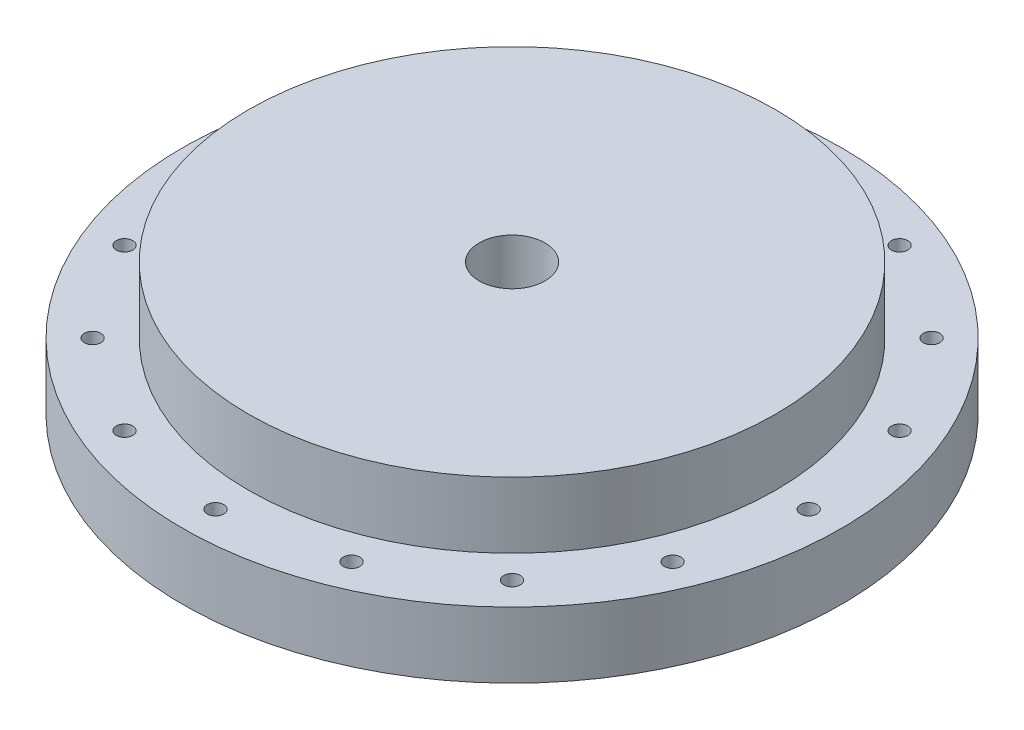
from build123d import *

# Parameters (mm, degrees)
SKETCH1_R           = 50.8
BOSS_EXTRUDE1_DEPTH = 25.4
SKETCH2_R           = 63.5
SKETCH2_R_2         = 50.8
BOSS_EXTRUDE2_DEPTH = 12.7
SKETCH3_R           = 50.00625
SKETCH3_R_2         = 47.625
CUT_EXTRUDE1_DEPTH  = 1.190625
CUT_EXTRUDE2_REACH  = 95.326
SKETCH4_R           = 1.5875
SKETCH5_R           = 6.35
CUT_EXTRUDE3_DEPTH  = 12.7
CUT_EXTRUDE4_REACH  = 92.696
SKETCH6_R           = 1.5875


with BuildPart() as part:
    # Sketch1 → Boss-Extrude1 (new body)
    with BuildSketch(Plane(origin=(0, 0, 0), x_dir=(1, 0, 0), z_dir=(0, 1, 0))):
        Circle(SKETCH1_R)
    extrude(amount=BOSS_EXTRUDE1_DEPTH)

    # Sketch2 → Boss-Extrude2 (add)
    with BuildSketch(Plane.XZ):
        Circle(SKETCH2_R)
        Circle(SKETCH2_R_2, mode=Mode.SUBTRACT)
    extrude(amount=-BOSS_EXTRUDE2_DEPTH)

    # Sketch3 → Cut-Extrude1 (cut)
    with BuildSketch(Plane.XZ):
        Circle(SKETCH3_R)
        Circle(SKETCH3_R_2, mode=Mode.SUBTRACT)
    extrude(amount=-CUT_EXTRUDE1_DEPTH, mode=Mode.SUBTRACT)

    # Sketch4 → Cut-Extrude2 (cut, up to next)
    with BuildSketch(Plane.XZ, mode=Mode.PRIVATE) as cut_extrude2_sk1:
        with Locations((0, -57.15)):
            Circle(SKETCH4_R)
    cut_extrude2_tool1 = extrude(cut_extrude2_sk1.sketch, amount=-CUT_EXTRUDE2_REACH, mode=Mode.PRIVATE) & part.part
    # Sketch4 → Cut-Extrude2 (cut, up to next)
    with BuildSketch(Plane.XZ, mode=Mode.PRIVATE) as cut_extrude2_sk2:
        with Locations((-21.87035816, -52.799715283)):
            Circle(SKETCH4_R)
    cut_extrude2_tool2 = extrude(cut_extrude2_sk2.sketch, amount=-CUT_EXTRUDE2_REACH, mode=Mode.PRIVATE) & part.part
    # Sketch4 → Cut-Extrude2 (cut, up to next)
    with BuildSketch(Plane.XZ, mode=Mode.PRIVATE) as cut_extrude2_sk3:
        with Locations((-40.411152545, -40.411152545)):
            Circle(SKETCH4_R)
    cut_extrude2_tool3 = extrude(cut_extrude2_sk3.sketch, amount=-CUT_EXTRUDE2_REACH, mode=Mode.PRIVATE) & part.part
    # Sketch4 → Cut-Extrude2 (cut, up to next)
    with BuildSketch(Plane.XZ, mode=Mode.PRIVATE) as cut_extrude2_sk4:
        with Locations((-52.799715283, -21.87035816)):
            Circle(SKETCH4_R)
    cut_extrude2_tool4 = extrude(cut_extrude2_sk4.sketch, amount=-CUT_EXTRUDE2_REACH, mode=Mode.PRIVATE) & part.part
    # Sketch4 → Cut-Extrude2 (cut, up to next)
    with BuildSketch(Plane.XZ, mode=Mode.PRIVATE) as cut_extrude2_sk5:
        with Locations((-57.15, 0)):
            Circle(SKETCH4_R)
    cut_extrude2_tool5 = extrude(cut_extrude2_sk5.sketch, amount=-CUT_EXTRUDE2_REACH, mode=Mode.PRIVATE) & part.part
    # Sketch4 → Cut-Extrude2 (cut, up to next)
    with BuildSketch(Plane.XZ, mode=Mode.PRIVATE) as cut_extrude2_sk6:
        with Locations((-52.799715283, 21.87035816)):
            Circle(SKETCH4_R)
    cut_extrude2_tool6 = extrude(cut_extrude2_sk6.sketch, amount=-CUT_EXTRUDE2_REACH, mode=Mode.PRIVATE) & part.part
    # Sketch4 → Cut-Extrude2 (cut, up to next)
    with BuildSketch(Plane.XZ, mode=Mode.PRIVATE) as cut_extrude2_sk7:
        with Locations((-40.411152545, 40.411152545)):
            Circle(SKETCH4_R)
    cut_extrude2_tool7 = extrude(cut_extrude2_sk7.sketch, amount=-CUT_EXTRUDE2_REACH, mode=Mode.PRIVATE) & part.part
    # Sketch4 → Cut-Extrude2 (cut, up to next)
    with BuildSketch(Plane.XZ, mode=Mode.PRIVATE) as cut_extrude2_sk8:
        with Locations((-21.87035816, 52.799715283)):
            Circle(SKETCH4_R)
    cut_extrude2_tool8 = extrude(cut_extrude2_sk8.sketch, amount=-CUT_EXTRUDE2_REACH, mode=Mode.PRIVATE) & part.part
    # Sketch4 → Cut-Extrude2 (cut, up to next)
    with BuildSketch(Plane.XZ, mode=Mode.PRIVATE) as cut_extrude2_sk9:
        with Locations((0, 57.15)):
            Circle(SKETCH4_R)
    cut_extrude2_tool9 = extrude(cut_extrude2_sk9.sketch, amount=-CUT_EXTRUDE2_REACH, mode=Mode.PRIVATE) & part.part
    # Sketch4 → Cut-Extrude2 (cut, up to next)
    with BuildSketch(Plane.XZ, mode=Mode.PRIVATE) as cut_extrude2_sk10:
        with Locations((21.87035816, 52.799715283)):
            Circle(SKETCH4_R)
    cut_extrude2_tool10 = extrude(cut_extrude2_sk10.sketch, amount=-CUT_EXTRUDE2_REACH, mode=Mode.PRIVATE) & part.part
    # Sketch4 → Cut-Extrude2 (cut, up to next)
    with BuildSketch(Plane.XZ, mode=Mode.PRIVATE) as cut_extrude2_sk11:
        with Locations((40.411152545, 40.411152545)):
            Circle(SKETCH4_R)
    cut_extrude2_tool11 = extrude(cut_extrude2_sk11.sketch, amount=-CUT_EXTRUDE2_REACH, mode=Mode.PRIVATE) & part.part
    # Sketch4 → Cut-Extrude2 (cut, up to next)
    with BuildSketch(Plane.XZ, mode=Mode.PRIVATE) as cut_extrude2_sk12:
        with Locations((52.799715283, 21.87035816)):
            Circle(SKETCH4_R)
    cut_extrude2_tool12 = extrude(cut_extrude2_sk12.sketch, amount=-CUT_EXTRUDE2_REACH, mode=Mode.PRIVATE) & part.part
    # Sketch4 → Cut-Extrude2 (cut, up to next)
    with BuildSketch(Plane.XZ, mode=Mode.PRIVATE) as cut_extrude2_sk13:
        with Locations((57.15, 0)):
            Circle(SKETCH4_R)
    cut_extrude2_tool13 = extrude(cut_extrude2_sk13.sketch, amount=-CUT_EXTRUDE2_REACH, mode=Mode.PRIVATE) & part.part
    # Sketch4 → Cut-Extrude2 (cut, up to next)
    with BuildSketch(Plane.XZ, mode=Mode.PRIVATE) as cut_extrude2_sk14:
        with Locations((52.799715283, -21.87035816)):
            Circle(SKETCH4_R)
    cut_extrude2_tool14 = extrude(cut_extrude2_sk14.sketch, amount=-CUT_EXTRUDE2_REACH, mode=Mode.PRIVATE) & part.part
    # Sketch4 → Cut-Extrude2 (cut, up to next)
    with BuildSketch(Plane.XZ, mode=Mode.PRIVATE) as cut_extrude2_sk15:
        with Locations((40.411152545, -40.411152545)):
            Circle(SKETCH4_R)
    cut_extrude2_tool15 = extrude(cut_extrude2_sk15.sketch, amount=-CUT_EXTRUDE2_REACH, mode=Mode.PRIVATE) & part.part
    # Sketch4 → Cut-Extrude2 (cut, up to next)
    with BuildSketch(Plane.XZ, mode=Mode.PRIVATE) as cut_extrude2_sk16:
        with Locations((21.87035816, -52.799715283)):
            Circle(SKETCH4_R)
    cut_extrude2_tool16 = extrude(cut_extrude2_sk16.sketch, amount=-CUT_EXTRUDE2_REACH, mode=Mode.PRIVATE) & part.part
    add(cut_extrude2_tool1.solids().sort_by_distance((0, 0, -57.15))[0], mode=Mode.SUBTRACT)
    add(cut_extrude2_tool2.solids().sort_by_distance((-21.870358, 0, -52.799715))[0], mode=Mode.SUBTRACT)
    add(cut_extrude2_tool3.solids().sort_by_distance((-40.411153, 0, -40.411153))[0], mode=Mode.SUBTRACT)
    add(cut_extrude2_tool4.solids().sort_by_distance((-52.799715, 0, -21.870358))[0], mode=Mode.SUBTRACT)
    add(cut_extrude2_tool5.solids().sort_by_distance((-57.15, 0, 0))[0], mode=Mode.SUBTRACT)
    add(cut_extrude2_tool6.solids().sort_by_distance((-52.799715, 0, 21.870358))[0], mode=Mode.SUBTRACT)
    add(cut_extrude2_tool7.solids().sort_by_distance((-40.411153, 0, 40.411153))[0], mode=Mode.SUBTRACT)
    add(cut_extrude2_tool8.solids().sort_by_distance((-21.870358, 0, 52.799715))[0], mode=Mode.SUBTRACT)
    add(cut_extrude2_tool9.solids().sort_by_distance((0, 0, 57.15))[0], mode=Mode.SUBTRACT)
    add(cut_extrude2_tool10.solids().sort_by_distance((21.870358, 0, 52.799715))[0], mode=Mode.SUBTRACT)
    add(cut_extrude2_tool11.solids().sort_by_distance((40.411153, 0, 40.411153))[0], mode=Mode.SUBTRACT)
    add(cut_extrude2_tool12.solids().sort_by_distance((52.799715, 0, 21.870358))[0], mode=Mode.SUBTRACT)
    add(cut_extrude2_tool13.solids().sort_by_distance((57.15, 0, 0))[0], mode=Mode.SUBTRACT)
    add(cut_extrude2_tool14.solids().sort_by_distance((52.799715, 0, -21.870358))[0], mode=Mode.SUBTRACT)
    add(cut_extrude2_tool15.solids().sort_by_distance((40.411153, 0, -40.411153))[0], mode=Mode.SUBTRACT)
    add(cut_extrude2_tool16.solids().sort_by_distance((21.870358, 0, -52.799715))[0], mode=Mode.SUBTRACT)

    # Sketch5 → Cut-Extrude3 (cut)
    with BuildSketch(Plane(origin=(0, 25.4, 0), x_dir=(1, 0, 0), z_dir=(0, 1, 0))):
        Circle(SKETCH5_R)
    extrude(amount=-CUT_EXTRUDE3_DEPTH, mode=Mode.SUBTRACT)

    # Sketch6 → Cut-Extrude4 (cut, up to next)
    with BuildSketch(Plane(origin=(0, 12.7, 0), x_dir=(1, 0, 0), z_dir=(0, 1, 0)), mode=Mode.PRIVATE) as cut_extrude4_sk1:
        Circle(SKETCH6_R)
    cut_extrude4_tool1 = extrude(cut_extrude4_sk1.sketch, amount=-CUT_EXTRUDE4_REACH, mode=Mode.PRIVATE) & part.part
    add(cut_extrude4_tool1.solids().sort_by_distance((0, 12.7, 0))[0], mode=Mode.SUBTRACT)


solid = part.part
